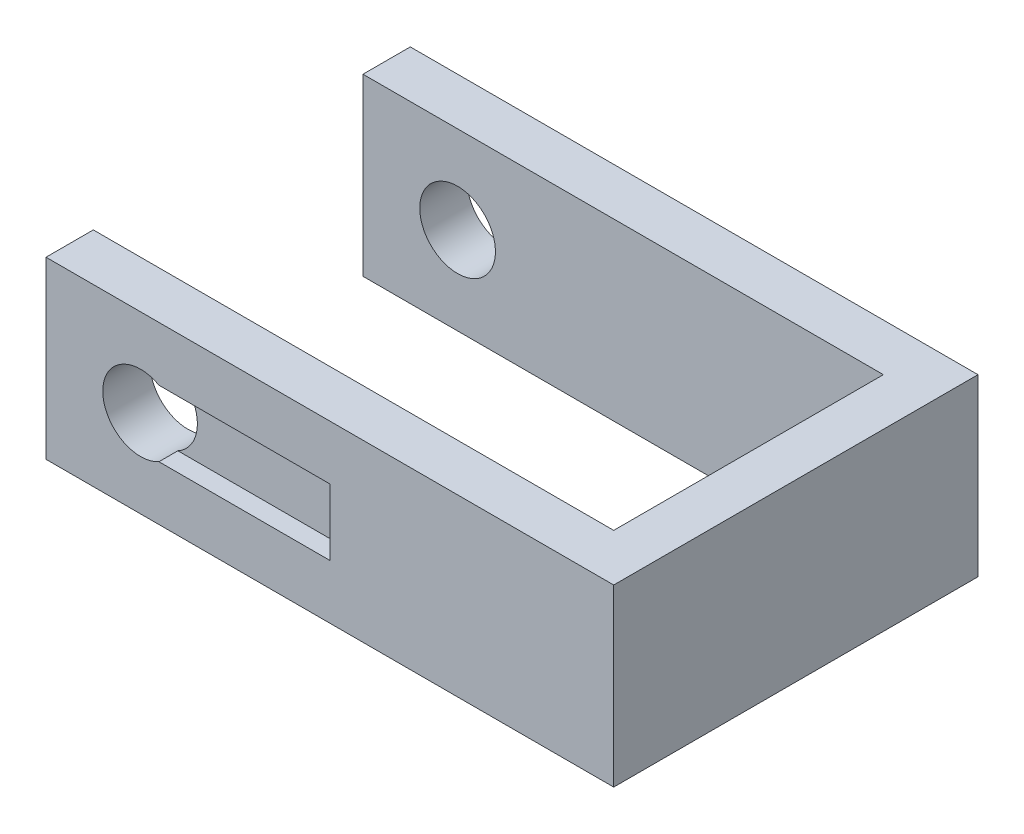
from build123d import *

# Parameters (mm, degrees)
BOSS_EXTRUDE2_DEPTH = 18.5
SKETCH5_R           = 4
CUT_EXTRUDE3_DEPTH  = 38.5
SKETCH6_W           = 20
SKETCH6_H           = 7
CUT_EXTRUDE4_DEPTH  = 2
SKETCH8_W           = 20
SKETCH8_H           = 7
CUT_EXTRUDE5_DEPTH  = 2


with BuildPart() as part:
    # Sketch1 → Boss-Extrude2 (new body)
    with BuildSketch(Plane(origin=(0, 0, 0), x_dir=(1, 0, 0), z_dir=(0, 1, 0))):
        Polygon((2.5, 19.25), (-57.5, 19.25), (-57.5, 14.25), (-2.5, 14.25), (-2.5, -14.25), (-57.5, -14.25), (-57.5, -19.25), (2.5, -19.25), align=None)
    extrude(amount=-BOSS_EXTRUDE2_DEPTH)

    # Sketch5 → Cut-Extrude3 (cut)
    with BuildSketch(Plane.XY.offset(19.25)):
        with Locations((-47.5, -9.25)):
            Circle(SKETCH5_R)
    extrude(amount=-CUT_EXTRUDE3_DEPTH, mode=Mode.SUBTRACT)

    # Sketch6 → Cut-Extrude4 (cut)
    with BuildSketch(Plane.XY.offset(19.25)):
        with Locations((-37.5, -9.25)):
            Rectangle(SKETCH6_W, SKETCH6_H)
    extrude(amount=-CUT_EXTRUDE4_DEPTH, mode=Mode.SUBTRACT)

    # Sketch8 → Cut-Extrude5 (cut)
    with BuildSketch(Plane(origin=(0, 0, -19.25), x_dir=(-1, 0, 0), z_dir=(0, 0, -1))):
        with Locations((37.5, -9.25)):
            Rectangle(SKETCH8_W, SKETCH8_H)
    extrude(amount=-CUT_EXTRUDE5_DEPTH, mode=Mode.SUBTRACT)


solid = part.part
